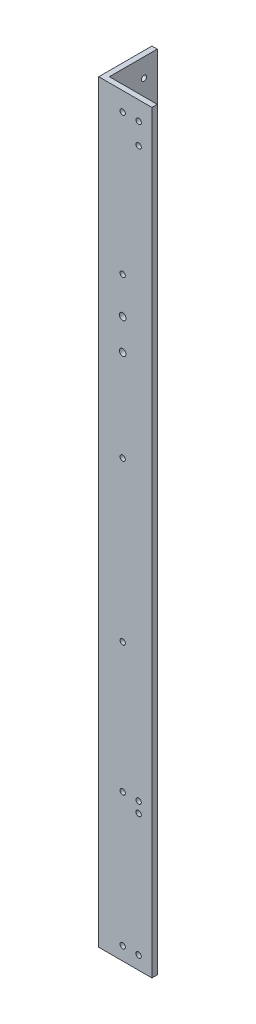
from build123d import *

# Parameters (mm, degrees)
BOSS_EXTRUDE1_DEPTH               = 450
FRONTSIDEHOLES_SKETCH3_R          = 1.5875
FRONTSIDEHOLES_SKETCH3_R_2        = 2
FRONTSIDEHOLES_CUT_EXTRUDE1_DEPTH = 3.175
LEFTSIDEHOLES_SKETCH4_R           = 1.5875
LEFTSIDEHOLES_CUT_EXTRUDE2_DEPTH  = 3.175


with BuildPart() as part:
    # Sketch2 → Boss-Extrude1 (new body)
    with BuildSketch(Plane(origin=(0, 0, 0), x_dir=(1, 0, 0), z_dir=(0, 1, 0))):
        Polygon((0, 31.75), (3.175, 31.75), (3.175, 3.175), (31.75, 3.175), (31.75, 0), (0, 0), align=None)
    extrude(amount=BOSS_EXTRUDE1_DEPTH)

    # FrontSideHoles-Sketch3 → FrontSideHoles-Cut-Extrude1 (cut)
    with BuildSketch(Plane.XY):
        with Locations((23.8125, 81.1125)):
            Circle(FRONTSIDEHOLES_SKETCH3_R)
        with Locations((14.2875, 87.4625)):
            Circle(FRONTSIDEHOLES_SKETCH3_R)
        with Locations((23.8125, 87.4625)):
            Circle(FRONTSIDEHOLES_SKETCH3_R)
        with Locations((14.2875, 438.8875)):
            Circle(FRONTSIDEHOLES_SKETCH3_R)
        with Locations((23.8125, 438.8875)):
            Circle(FRONTSIDEHOLES_SKETCH3_R)
        with Locations((23.8125, 426.1875)):
            Circle(FRONTSIDEHOLES_SKETCH3_R)
        with Locations((14.2875, 333.177644)):
            Circle(FRONTSIDEHOLES_SKETCH3_R_2)
        with Locations((14.2875, 314.652644)):
            Circle(FRONTSIDEHOLES_SKETCH3_R_2)
        with Locations((14.2875, 260)):
            Circle(FRONTSIDEHOLES_SKETCH3_R)
        with Locations((14.2875, 165)):
            Circle(FRONTSIDEHOLES_SKETCH3_R)
        with Locations((14.2875, 355)):
            Circle(FRONTSIDEHOLES_SKETCH3_R)
        with Locations((14.2875, 7.9375)):
            Circle(FRONTSIDEHOLES_SKETCH3_R)
        with Locations((23.8125, 7.9375)):
            Circle(FRONTSIDEHOLES_SKETCH3_R)
    extrude(amount=-FRONTSIDEHOLES_CUT_EXTRUDE1_DEPTH, mode=Mode.SUBTRACT)

    # LeftSideHoles-Sketch4 → LeftSideHoles-Cut-Extrude2 (cut)
    with BuildSketch(Plane.ZY):
        with Locations((-23.8125, 81.1125)):
            Circle(LEFTSIDEHOLES_SKETCH4_R)
        with Locations((-14.2875, 81.1125)):
            Circle(LEFTSIDEHOLES_SKETCH4_R)
        with Locations((-23.8125, 87.4625)):
            Circle(LEFTSIDEHOLES_SKETCH4_R)
        with Locations((-23.8125, 438.8875)):
            Circle(LEFTSIDEHOLES_SKETCH4_R)
        with Locations((-23.8125, 426.1875)):
            Circle(LEFTSIDEHOLES_SKETCH4_R)
        with Locations((-14.2875, 426.1875)):
            Circle(LEFTSIDEHOLES_SKETCH4_R)
        with Locations((-23.8125, 327.602644)):
            Circle(LEFTSIDEHOLES_SKETCH4_R)
        with Locations((-14.2875, 327.602644)):
            Circle(LEFTSIDEHOLES_SKETCH4_R)
        with Locations((-23.8125, 314.902644)):
            Circle(LEFTSIDEHOLES_SKETCH4_R)
        with Locations((-14.2875, 314.902644)):
            Circle(LEFTSIDEHOLES_SKETCH4_R)
        with Locations((-23.8125, 7.9375)):
            Circle(LEFTSIDEHOLES_SKETCH4_R)
        with Locations((-14.2875, 7.9375)):
            Circle(LEFTSIDEHOLES_SKETCH4_R)
        with Locations((-14.2875, 165)):
            Circle(LEFTSIDEHOLES_SKETCH4_R)
        with Locations((-14.2875, 260)):
            Circle(LEFTSIDEHOLES_SKETCH4_R)
        with Locations((-14.2875, 355)):
            Circle(LEFTSIDEHOLES_SKETCH4_R)
    extrude(amount=-LEFTSIDEHOLES_CUT_EXTRUDE2_DEPTH, mode=Mode.SUBTRACT)


solid = part.part
